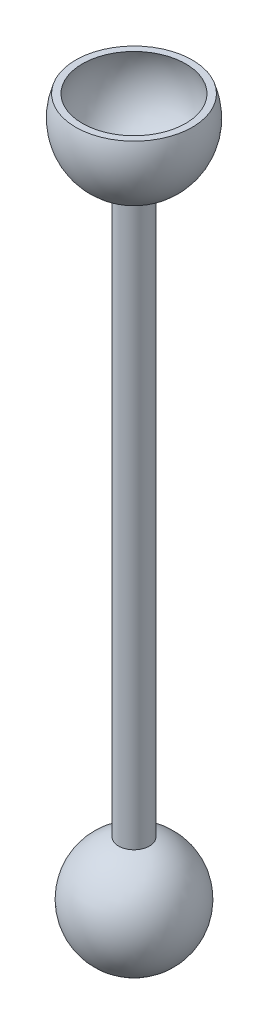
from build123d import *

# Parameters (mm, degrees)
BOSS_EXTRUDE1_REACH             = 24.045
BOSS_EXTRUDE1_END_RADIUS        = 9
SKETCH3_R                       = 2.5
BOSS_EXTRUDE1_DIRECTION_2_DEPTH = 100
CUT_EXTRUDE1_DEPTH              = 10
CUT_EXTRUDE1_DEPTH_BACK         = 10
SKETCH5_W                       = 20
SKETCH5_H                       = 8.579104118


# Read off the part's stored shape, not the designer's step: Shell1
with BuildPart() as part:
    # Sketch1 → Revolve1 (revolve)
    with BuildSketch(Plane.XY):
        with BuildLine():
            Line((0, -9), (0, 9))
            ThreePointArc((0, 9), (9, 0), (0, -9))
        make_face()
    revolve(axis=Axis((0, -9, 0), (0, 1, 0)))

    # Boss-Extrude1: up to this sphere (the profile starts outside it)
    boss_extrude1_end = Location((0, 0, 0)) * Sphere(BOSS_EXTRUDE1_END_RADIUS, mode=Mode.PRIVATE)
    # Sketch3 → Boss-Extrude1 (add, up to the surface)
    with BuildSketch(Plane(origin=(0, 9, 0), x_dir=(1, 0, 0), z_dir=(0, 1, 0)), mode=Mode.PRIVATE) as boss_extrude1_sk1:
        with Locations(Location((0, 0, 0), (0, 0, 90))):
            Circle(SKETCH3_R)
    boss_extrude1_tool1 = extrude(boss_extrude1_sk1.sketch, amount=-BOSS_EXTRUDE1_REACH, mode=Mode.PRIVATE) - boss_extrude1_end
    add(boss_extrude1_tool1.solids().sort_by_distance((0, 9, 0))[0])

    # Sketch3 → Boss-Extrude1 direction 2 (add)
    with BuildSketch(Plane(origin=(0, 9, 0), x_dir=(1, 0, 0), z_dir=(0, 1, 0))):
        with Locations(Location((0, 0, 0), (0, 0, 90))):
            Circle(SKETCH3_R)
    extrude(amount=BOSS_EXTRUDE1_DIRECTION_2_DEPTH)

    # Sketch4 → Revolve2 (revolve)
    with BuildSketch(Plane(origin=(0, 0, 0), x_dir=(0, 0, -1), z_dir=(1, 0, 0))):
        with BuildLine():
            Line((0, 109), (0, 99))
            ThreePointArc((0, 99), (10, 109), (0, 119))
            Line((0, 119), (0, 109))
        make_face()
    revolve(axis=Axis((0, 109, 0), (0, 1, 0)))

    # Sketch5 → Cut-Extrude1 (cut, two sides: drawn at the far end of the back side and taken through both)
    with BuildSketch(Plane(origin=(0, 0, 0), x_dir=(0, 0, -1), z_dir=(1, 0, 0)).offset(-CUT_EXTRUDE1_DEPTH_BACK)):
        with Locations((0, 116.710447941)):
            Rectangle(SKETCH5_W, SKETCH5_H)
    extrude(amount=CUT_EXTRUDE1_DEPTH + CUT_EXTRUDE1_DEPTH_BACK, mode=Mode.SUBTRACT)

    # Shell1 outline → Shell1 (revolve, cut)
    with BuildSketch(Plane.XY):
        with BuildLine():
            Line((0, 112.42089589), (0, 100))
            ThreePointArc((0, 100), (7.476231103, 103.989414356), (8.324510274, 112.42089589))
            Line((8.324510274, 112.42089589), (0, 112.42089589))
        make_face()
    revolve(axis=Axis((0, 0, 0), (0, 1, 0)), mode=Mode.SUBTRACT)


solid = part.part
